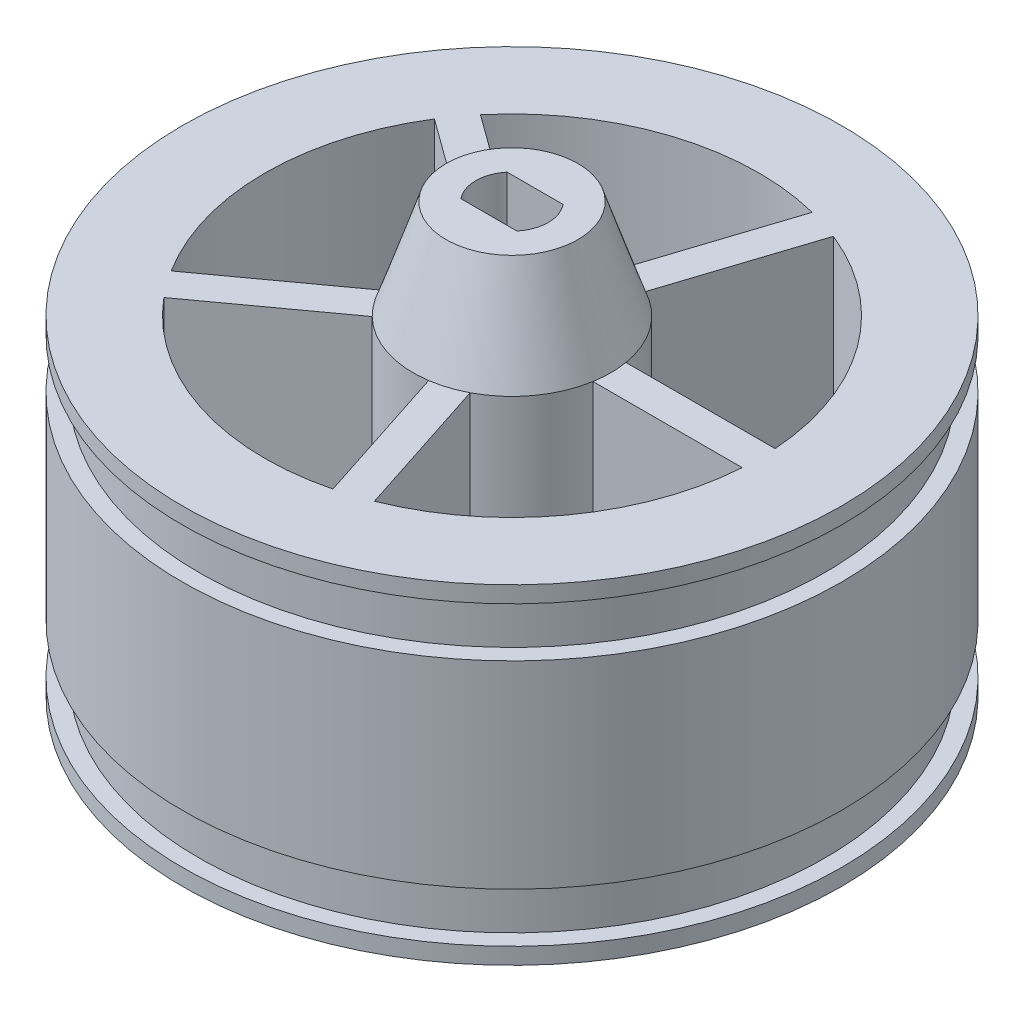
from build123d import *

# Parameters (mm, degrees)
SKETCH2_R              = 3.175
CUT_EXTRUDE1_DEPTH     = 6.35
CUT_EXTRUDE2_START     = 6.35
CUT_EXTRUDE2_OUTLINE_R = 1.75
CUT_EXTRUDE2_DEPTH     = 19.05
CUT_EXTRUDE3_DEPTH     = 7.62
CUT_EXTRUDE4_DEPTH     = 44.994090512


# Read off the part's stored shape, not the designer's step: Cut-Extrude2
with BuildPart() as part:
    # Sketch1 → Revolve1 (revolve)
    with BuildSketch(Plane.XY, mode=Mode.PRIVATE) as revolve1_sk:
        Polygon((0, 33.02), (0, 25.4), (7.62, 25.4), (5.08, 33.02), align=None)
        Polygon((0, 25.4), (0, 12.7), (25.4, 12.7), (25.4, 20.32), (24.13, 20.32), (24.13, 24.13), (25.4, 24.13), (25.4, 25.4), (7.62, 25.4), align=None)
        Polygon((0, 12.7), (0, 0), (25.4, 0), (25.4, 1.27), (24.13, 1.27), (24.13, 5.08), (25.4, 5.08), (25.4, 12.7), align=None)
    revolve(revolve1_sk.sketch.rotate(Axis((0, 25.4, 0), (0, -1, 0)), 180), axis=Axis((0, 25.4, 0), (0, -1, 0)))

    # Sketch2 → Cut-Extrude1 (cut)
    with BuildSketch(Plane(origin=(0, 0, 0), x_dir=(-1, 0, 0), z_dir=(0, -1, 0))):
        with Locations(Location((0, 0, 0), (0, 0, 180))):
            Circle(SKETCH2_R)
    extrude(amount=-CUT_EXTRUDE1_DEPTH, mode=Mode.SUBTRACT)

    # Cut-Extrude2 outline → Cut-Extrude2 (cut)
    with BuildSketch(Plane(origin=(0, 0, 0), x_dir=(1, 0, 0), z_dir=(0, 1, 0)).offset(CUT_EXTRUDE2_START)):
        Circle(CUT_EXTRUDE2_OUTLINE_R)
    extrude(amount=CUT_EXTRUDE2_DEPTH, mode=Mode.SUBTRACT)

    # Sketch3 → Cut-Extrude3 (cut)
    with BuildSketch(Plane(origin=(0, 33.02, 0), x_dir=(1, 0, 0), z_dir=(0, 1, 0))):
        with BuildLine():
            Line((2.155261469, 1.778), (-2.155261469, 1.778))
            ThreePointArc((-2.155261469, 1.778), (-2.794, 0), (-2.155261469, -1.778))
            Line((-2.155261469, -1.778), (2.155261469, -1.778))
            ThreePointArc((2.155261469, -1.778), (2.629471101, -0.944625708), (2.794, 0))
            ThreePointArc((2.794, 0), (2.629471101, 0.944625708), (2.155261469, 1.778))
        make_face()
    extrude(amount=-CUT_EXTRUDE3_DEPTH, mode=Mode.SUBTRACT)

    # Sketch4 → Cut-Extrude4 (cut, through all)
    with BuildSketch(Plane(origin=(0, 25.4, 0), x_dir=(1, 0, 0), z_dir=(0, 1, 0))):
        with BuildLine():
            ThreePointArc((-5.331998267, 5.443729832), (-2.354709497, 7.247050654), (1.113933099, 7.538139893))
            Line((1.113933099, 7.538139893), (4.66583568, 18.469771991))
            ThreePointArc((4.66583568, 18.469771991), (-5.886773743, 18.117626635), (-14.630999948, 12.199850021))
            Line((-14.630999948, 12.199850021), (-5.331998267, 5.443729832))
        make_face()
        with BuildLine():
            Line((-16.123974489, -10.144946855), (-6.824972808, -3.388826666))
            ThreePointArc((-6.824972808, -3.388826666), (-7.62, 0), (-6.824972808, 3.388826666))
            Line((-6.824972808, 3.388826666), (-16.123974489, 10.144946855))
            ThreePointArc((-16.123974489, 10.144946855), (-19.05, 0), (-16.123974489, -10.144946855))
        make_face()
        with BuildLine():
            Line((4.66583568, -18.469771991), (1.113933099, -7.538139893))
            ThreePointArc((1.113933099, -7.538139893), (-2.354709497, -7.247050654), (-5.331998267, -5.443729832))
            Line((-5.331998267, -5.443729832), (-14.630999948, -12.199850021))
            ThreePointArc((-14.630999948, -12.199850021), (-5.886773743, -18.117626635), (4.66583568, -18.469771991))
        make_face()
        with BuildLine():
            Line((19.007619525, -1.27), (7.513421325, -1.27))
            ThreePointArc((7.513421325, -1.27), (6.164709497, -4.478923622), (3.529616651, -6.753236728))
            Line((3.529616651, -6.753236728), (7.081519231, -17.684868825))
            ThreePointArc((7.081519231, -17.684868825), (15.411773743, -11.197309056), (19.007619525, -1.27))
        make_face()
        with BuildLine():
            ThreePointArc((3.529616651, 6.753236728), (6.164709497, 4.478923622), (7.513421325, 1.27))
            Line((7.513421325, 1.27), (19.007619525, 1.27))
            ThreePointArc((19.007619525, 1.27), (15.411773743, 11.197309056), (7.081519231, 17.684868825))
            Line((7.081519231, 17.684868825), (3.529616651, 6.753236728))
        make_face()
    extrude(amount=-CUT_EXTRUDE4_DEPTH, mode=Mode.SUBTRACT)


solid = part.part
